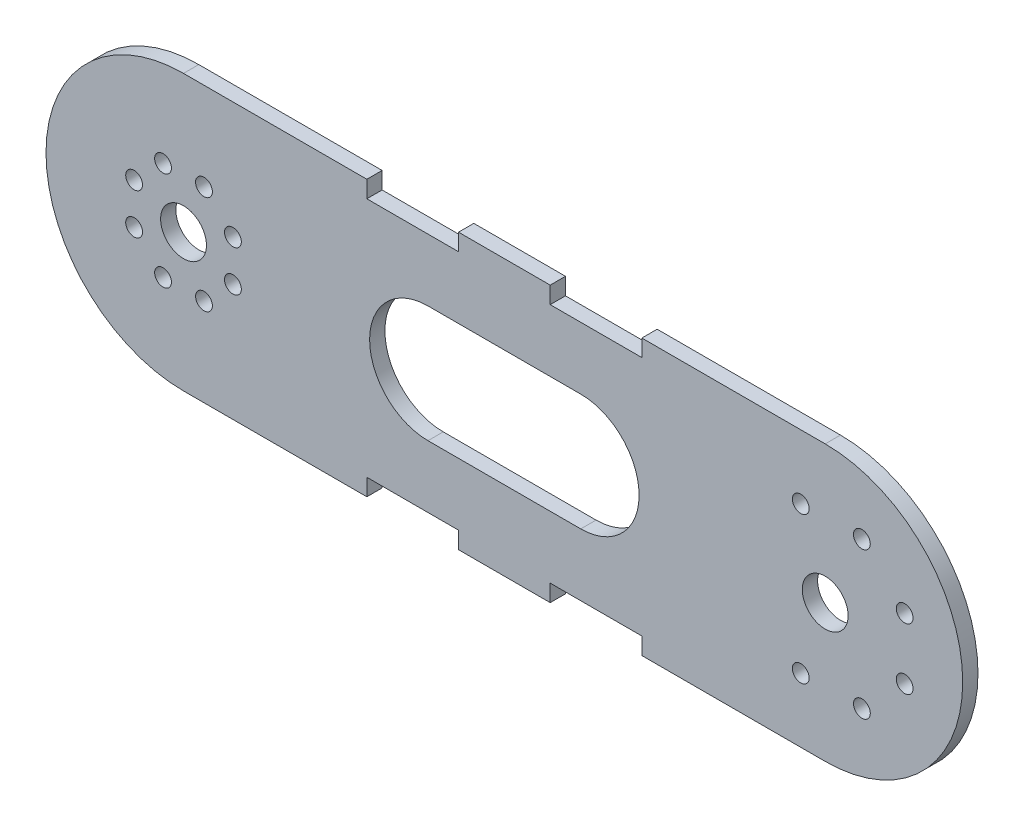
from build123d import *

# Parameters (mm, degrees)
SKETCH3_R           = 2.75
SKETCH3_R_2         = 7.5
BOSS_EXTRUDE1_DEPTH = 5


with BuildPart() as part:
    # Sketch3 → Boss-Extrude1 (new body)
    with BuildSketch(Plane.XY):
        with BuildLine():
            Line((39.037250972, 45), (-20.962749028, 45))
            ThreePointArc((-20.962749028, 45), (-65.962749028, 0), (-20.962749028, -45))
            Line((-20.962749028, -45), (39.037250972, -45))
            Line((39.037250972, -45), (39.037250972, -39.46))
            Line((39.037250972, -39.46), (69.037250972, -39.46))
            Line((69.037250972, -39.46), (69.037250972, -45))
            Line((69.037250972, -45), (99.037250972, -45))
            Line((99.037250972, -45), (99.037250972, -39.46))
            Line((99.037250972, -39.46), (129.037250972, -39.46))
            Line((129.037250972, -39.46), (129.037250972, -45))
            Line((129.037250972, -45), (189.037250972, -45))
            ThreePointArc((189.037250972, -45), (234.037250972, 0), (189.037250972, 45))
            Line((189.037250972, 45), (129.037250972, 45))
            Line((129.037250972, 45), (129.037250972, 39.46))
            Line((129.037250972, 39.46), (99.037250972, 39.46))
            Line((99.037250972, 39.46), (99.037250972, 45))
            Line((99.037250972, 45), (69.037250972, 45))
            Line((69.037250972, 45), (69.037250972, 39.46))
            Line((69.037250972, 39.46), (39.037250972, 39.46))
            Line((39.037250972, 39.46), (39.037250972, 45))
        make_face()
        with Locations((-27.659709094, -16.167891819)):
            Circle(SKETCH3_R, mode=Mode.SUBTRACT)
        with Locations((-14.265788962, -16.167891819)):
            Circle(SKETCH3_R, mode=Mode.SUBTRACT)
        with Locations((-37.130640847, -6.696960066)):
            Circle(SKETCH3_R, mode=Mode.SUBTRACT)
        with Locations((-4.794857209, -6.696960066)):
            Circle(SKETCH3_R, mode=Mode.SUBTRACT)
        with BuildLine():
            ThreePointArc((-13.462749028, 0), (-28.318638631, -1.463177415), (-14.033652534, 2.870125743))
            ThreePointArc((-14.033652534, 2.870125743), (-13.606859425, 1.463177415), (-13.462749028, 0))
        make_face(mode=Mode.SUBTRACT)
        with Locations((181.037250972, -24)):
            Circle(SKETCH3_R, mode=Mode.SUBTRACT)
        with Locations((201.037250972, -24)):
            Circle(SKETCH3_R, mode=Mode.SUBTRACT)
        with BuildLine():
            ThreePointArc((59.037250972, -19.094555463), (39.942695509, 0), (59.037250972, 19.094555463))
            Line((59.037250972, 19.094555463), (109.037250972, 19.094555463))
            ThreePointArc((109.037250972, 19.094555463), (128.131806435, 0), (109.037250972, -19.094555463))
            Line((109.037250972, -19.094555463), (59.037250972, -19.094555463))
        make_face(mode=Mode.SUBTRACT)
        with Locations((215.037250972, -10)):
            Circle(SKETCH3_R, mode=Mode.SUBTRACT)
        with Locations((-37.130640847, 6.696960066)):
            Circle(SKETCH3_R, mode=Mode.SUBTRACT)
        with BuildLine():
            ThreePointArc((-2.044857209, 6.696960066), (-4.258358823, 3.999800545), (-7.335525923, 5.644580627))
            ThreePointArc((-7.335525923, 5.644580627), (-5.331355595, 9.394119587), (-2.044857209, 6.696960066))
        make_face(mode=Mode.SUBTRACT)
        with Locations((-27.659709094, 16.167891819)):
            Circle(SKETCH3_R, mode=Mode.SUBTRACT)
        with Locations((-14.265788962, 16.167891819)):
            Circle(SKETCH3_R, mode=Mode.SUBTRACT)
        with Locations((189.037250972, 0)):
            Circle(SKETCH3_R_2, mode=Mode.SUBTRACT)
        with Locations((215.037250972, 10)):
            Circle(SKETCH3_R, mode=Mode.SUBTRACT)
        with Locations((181.037250972, 24)):
            Circle(SKETCH3_R, mode=Mode.SUBTRACT)
        with Locations((201.037250972, 24)):
            Circle(SKETCH3_R, mode=Mode.SUBTRACT)
    extrude(amount=BOSS_EXTRUDE1_DEPTH)


solid = part.part
